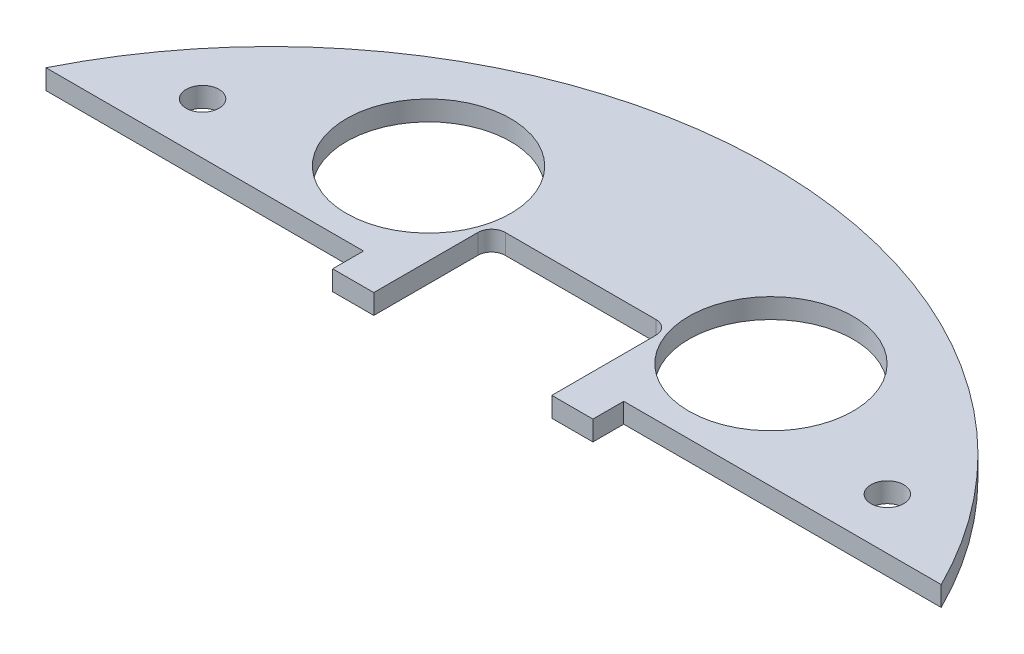
from build123d import *

# Parameters (mm, degrees)
BOSS_EXTRUDE1_DEPTH     = 2.9
SOLENOID_PLACEMENT_W    = 38
SOLENOID_PLACEMENT_H    = 64
CUT_EXTRUDE1_DEPTH      = 104.278313309
CUT_EXTRUDE4_DEPTH      = 104.278313309
SKETCH5_R               = 12
CUT_EXTRUDE5_DEPTH      = 104.278313309
SKETCH6_R               = 2.4
CUT_EXTRUDE6_DEPTH      = 104.278313309
CUT_EXTRUDE3_DEPTH      = 104.278313309
CUT_EXTRUDE9_DEPTH      = 99.031423533
CUT_EXTRUDE9_DEPTH_BACK = 99.031423533
SKETCH8_W               = 10
SKETCH8_H               = 62.80248699


with BuildPart() as part:
    # Sketch1 → Boss-Extrude1 (new body)
    with BuildSketch(Plane(origin=(0, 0, 0), x_dir=(1, 0, 0), z_dir=(0, 1, 0))):
        with BuildLine():
            ThreePointArc((36.856602833, -63.012624351), (0, 73), (-36.856602833, -63.012624351))
            ThreePointArc((-36.856602833, -63.012624351), (-33.368752207, -63.602994345), (-30.363140064, -61.737536127))
            ThreePointArc((-30.363140064, -61.737536127), (0, -46.75), (30.363140064, -61.737536127))
            ThreePointArc((30.363140064, -61.737536127), (33.368752207, -63.602994345), (36.856602833, -63.012624351))
        make_face()
    extrude(amount=BOSS_EXTRUDE1_DEPTH)

    # solenoid placement → Cut-Extrude1 (cut, through all)
    with BuildSketch(Plane(origin=(0, 2.9, 0), x_dir=(1, 0, 0), z_dir=(0, 1, 0))):
        with Locations((0, -4)):
            Rectangle(SOLENOID_PLACEMENT_W, SOLENOID_PLACEMENT_H)
    extrude(amount=-CUT_EXTRUDE1_DEPTH, mode=Mode.SUBTRACT)

    # Sketch4 → Cut-Extrude4 (cut, through all)
    with BuildSketch(Plane(origin=(0, 2.9, 0), x_dir=(1, 0, 0), z_dir=(0, 1, 0))):
        with BuildLine():
            Line((-13, 28), (13, 28))
            Line((13, 28), (13, 43.2))
            ThreePointArc((13, 43.2), (12.414213562, 44.614213562), (11, 45.2))
            Line((11, 45.2), (-11, 45.2))
            ThreePointArc((-11, 45.2), (-12.414213562, 44.614213562), (-13, 43.2))
            Line((-13, 43.2), (-13, 28))
        make_face()
    extrude(amount=-CUT_EXTRUDE4_DEPTH, mode=Mode.SUBTRACT)

    # Sketch5 → Cut-Extrude5 (cut, through all)
    with BuildSketch(Plane(origin=(0, 2.9, 0), x_dir=(1, 0, 0), z_dir=(0, 1, 0))):
        with Locations((-25, 48)):
            Circle(SKETCH5_R)
        with Locations((25, 48)):
            Circle(SKETCH5_R)
    extrude(amount=-CUT_EXTRUDE5_DEPTH, mode=Mode.SUBTRACT)

    # Sketch6 → Cut-Extrude6 (cut, through all)
    with BuildSketch(Plane(origin=(0, 2.9, 0), x_dir=(1, 0, 0), z_dir=(0, 1, 0))):
        with Locations((40, -40)):
            Circle(SKETCH6_R)
        with Locations((-40, -40)):
            Circle(SKETCH6_R)
        with Locations((-50, 40)):
            Circle(SKETCH6_R)
        with Locations((50, 40)):
            Circle(SKETCH6_R)
    extrude(amount=-CUT_EXTRUDE6_DEPTH, mode=Mode.SUBTRACT)

    # Sketch3 → Cut-Extrude3 (cut, through all)
    with BuildSketch(Plane(origin=(0, 2.9, 0), x_dir=(1, 0, 0), z_dir=(0, 1, 0))):
        Polygon((-19, 28), (19, 28), (19, 32.5), (73, 32.5), (73, -32.5), (-73, -32.5), (-73, 32.5), (-19, 32.5), align=None)
    extrude(amount=-CUT_EXTRUDE3_DEPTH, mode=Mode.SUBTRACT)


with BuildPart() as cut_extrude3_piece_1:
    # of the separate pieces the step leaves, piece 1, a body of its own (cut_extrude3_pieces)
    add(part.part.solids().sort_by_distance((65.366275709, 0, -32.5))[0])


with BuildPart() as cut_extrude3_piece_2:
    # of the separate pieces the step leaves, piece 2, a body of its own (cut_extrude3_pieces)
    add(part.part.solids().sort_by_distance((-36.856602833, 0, 63.012624351))[0])

    # Sketch8 → Cut-Extrude9 (cut, two sides: drawn at the far end of the back side and taken through both)
    with BuildSketch(Plane(origin=(0, 2.9, 0), x_dir=(1, 0, 0), z_dir=(0, 1, 0)).offset(-CUT_EXTRUDE9_DEPTH_BACK)):
        with Locations((0, -31.401243495)):
            Rectangle(SKETCH8_W, SKETCH8_H)
    extrude(amount=CUT_EXTRUDE9_DEPTH + CUT_EXTRUDE9_DEPTH_BACK, mode=Mode.SUBTRACT)


with BuildPart() as cut_extrude9_piece_1:
    # of the separate pieces the step leaves, piece 1, a body of its own (cut_extrude9_pieces)
    add(cut_extrude3_piece_2.part.solids().sort_by_distance((5, 0, 47.078205475))[0])


with BuildPart() as cut_extrude9_piece_2:
    # of the separate pieces the step leaves, piece 2, a body of its own (cut_extrude9_pieces)
    add(cut_extrude3_piece_2.part.solids().sort_by_distance((-36.856602833, 0, 63.012624351))[0])


solid = cut_extrude3_piece_1.part
